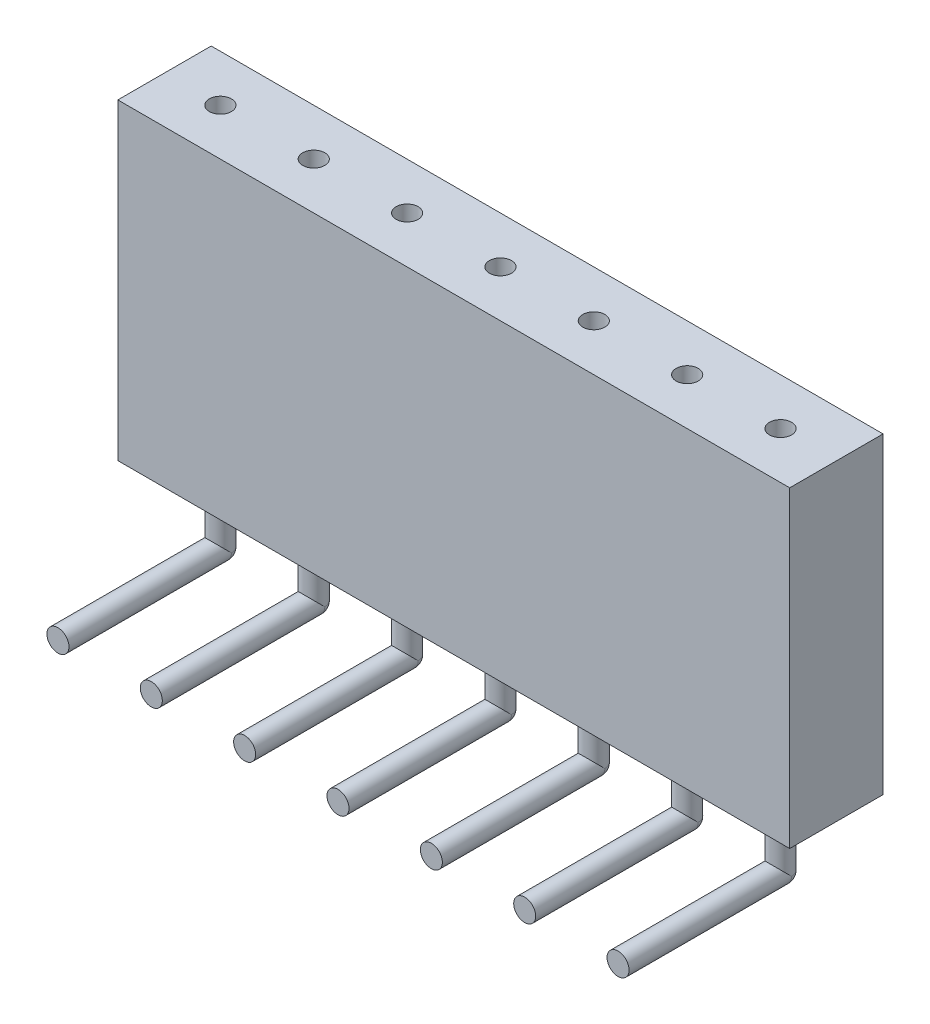
from build123d import *

# Parameters (mm, degrees)
SKETCH_1_W             = 18.28
SKETCH_1_H             = 2.54
EXTRUDE_1_DEPTH        = 8.5
SKETCH_2_R             = 0.3
CUT_EXTRUDE_1_DEPTH    = 8.5
SKETCH_3_R             = 0.3
EXTRUDE_2_DEPTH        = 1.9
EXTRUDE_2_2_DEPTH      = 1.9
EXTRUDE_2_3_DEPTH      = 1.9
EXTRUDE_2_4_DEPTH      = 1.9
EXTRUDE_2_5_DEPTH      = 1.9
EXTRUDE_2_6_DEPTH      = 1.9
EXTRUDE_2_7_DEPTH      = 1.9
EXTRUDE_3_DEPTH        = 4.42
EXTRUDE_3_DEPTH_BACK   = 0.3
SKETCH_4_R             = 0.3
EXTRUDE_3_2_DEPTH      = 4.42
EXTRUDE_3_2_DEPTH_BACK = 0.3
EXTRUDE_3_3_DEPTH      = 4.42
EXTRUDE_3_3_DEPTH_BACK = 0.3
EXTRUDE_3_4_DEPTH      = 4.42
EXTRUDE_3_4_DEPTH_BACK = 0.3
EXTRUDE_3_5_DEPTH      = 4.42
EXTRUDE_3_5_DEPTH_BACK = 0.3
EXTRUDE_3_6_DEPTH      = 4.42
EXTRUDE_3_6_DEPTH_BACK = 0.3
EXTRUDE_3_7_DEPTH      = 4.42
EXTRUDE_3_7_DEPTH_BACK = 0.3
FILLET_2_R             = 0.3
FILLET_3_R             = 0.3
FILLET_4_R             = 0.3
FILLET_5_R             = 0.3
FILLET_6_R             = 0.3
FILLET_7_R             = 0.3
FILLET_8_R             = 0.3


with BuildPart() as part:
    # Эскиз1 → Бобышка-Вытянуть1 (new body)
    with BuildSketch(Plane(origin=(0, 0, 0), x_dir=(1, 0, 0), z_dir=(0, 1, 0))):
        Rectangle(SKETCH_1_W, SKETCH_1_H)
    extrude(amount=EXTRUDE_1_DEPTH)

    # Эскиз2 → Вырез-Вытянуть1 (cut)
    with BuildSketch(Plane(origin=(0, 8.5, 0), x_dir=(1, 0, 0), z_dir=(0, 1, 0))):
        with Locations(Location((-7.62, 0, 0), (0, 0, 270))):
            Circle(SKETCH_2_R)
        with Locations(Location((-5.08, 0, 0), (0, 0, 270))):
            Circle(SKETCH_2_R)
        with Locations(Location((-2.54, 0, 0), (0, 0, 270))):
            Circle(SKETCH_2_R)
        with Locations(Location((0, 0, 0), (0, 0, 270))):
            Circle(SKETCH_2_R)
        with Locations(Location((2.54, 0, 0), (0, 0, 270))):
            Circle(SKETCH_2_R)
        with Locations(Location((5.08, 0, 0), (0, 0, 270))):
            Circle(SKETCH_2_R)
        with Locations(Location((7.62, 0, 0), (0, 0, 270))):
            Circle(SKETCH_2_R)
    extrude(amount=-CUT_EXTRUDE_1_DEPTH, mode=Mode.SUBTRACT)


with BuildPart() as body_2:
    # Эскиз3 → Бобышка-Вытянуть2 (new body)
    with BuildSketch(Plane.XZ):
        with Locations(Location((-7.62, 0, 0), (0, 0, 270))):
            Circle(SKETCH_3_R)
    extrude(amount=EXTRUDE_2_DEPTH)


with BuildPart() as body_3:
    # Эскиз3 → Extrude 2 2 (new body)
    with BuildSketch(Plane.XZ):
        with Locations(Location((-5.08, 0, 0), (0, 0, 270))):
            Circle(SKETCH_3_R)
    extrude(amount=EXTRUDE_2_2_DEPTH)


with BuildPart() as body_4:
    # Эскиз3 → Extrude 2 3 (new body)
    with BuildSketch(Plane.XZ):
        with Locations(Location((-2.54, 0, 0), (0, 0, 270))):
            Circle(SKETCH_3_R)
    extrude(amount=EXTRUDE_2_3_DEPTH)


with BuildPart() as body_5:
    # Эскиз3 → Extrude 2 4 (new body)
    with BuildSketch(Plane.XZ):
        with Locations(Location((0, 0, 0), (0, 0, 270))):
            Circle(SKETCH_3_R)
    extrude(amount=EXTRUDE_2_4_DEPTH)


with BuildPart() as body_6:
    # Эскиз3 → Extrude 2 5 (new body)
    with BuildSketch(Plane.XZ):
        with Locations(Location((2.54, 0, 0), (0, 0, 270))):
            Circle(SKETCH_3_R)
    extrude(amount=EXTRUDE_2_5_DEPTH)


with BuildPart() as body_7:
    # Эскиз3 → Extrude 2 6 (new body)
    with BuildSketch(Plane.XZ):
        with Locations(Location((5.08, 0, 0), (0, 0, 270))):
            Circle(SKETCH_3_R)
    extrude(amount=EXTRUDE_2_6_DEPTH)


with BuildPart() as body_8:
    # Эскиз3 → Extrude 2 7 (new body)
    with BuildSketch(Plane.XZ):
        with Locations(Location((7.62, 0, 0), (0, 0, 270))):
            Circle(SKETCH_3_R)
    extrude(amount=EXTRUDE_2_7_DEPTH)


with BuildPart() as body_9:
    # Эскиз4 → Бобышка-Вытянуть3 (new, two sides: drawn at the far end of the back side and taken through both)
    with BuildSketch(Plane.XY.offset(-EXTRUDE_3_DEPTH_BACK)):
        with Locations((-7.62, -1.9)):
            Circle(SKETCH_4_R)
    extrude(amount=EXTRUDE_3_DEPTH + EXTRUDE_3_DEPTH_BACK)

    # Скругление2
    fillet_2_edges = [body_9.edges().sort_by_distance(p)[0] for p in [
        (-7.92, -1.9, -0.3),
    ]]
    fillet(fillet_2_edges, radius=FILLET_2_R - 0.0001)  # a hair under: the kernel refuses the full size


with BuildPart() as body_10:
    # Эскиз4 → Extrude 3 2 (new, two sides: drawn at the far end of the back side and taken through both)
    with BuildSketch(Plane.XY.offset(-EXTRUDE_3_2_DEPTH_BACK)):
        with Locations((-5.08, -1.9)):
            Circle(SKETCH_4_R)
    extrude(amount=EXTRUDE_3_2_DEPTH + EXTRUDE_3_2_DEPTH_BACK)

    # Скругление3
    fillet_3_edges = [body_10.edges().sort_by_distance(p)[0] for p in [
        (-5.38, -1.9, -0.3),
    ]]
    fillet(fillet_3_edges, radius=FILLET_3_R - 0.0001)  # a hair under: the kernel refuses the full size


with BuildPart() as body_11:
    # Эскиз4 → Extrude 3 3 (new, two sides: drawn at the far end of the back side and taken through both)
    with BuildSketch(Plane.XY.offset(-EXTRUDE_3_3_DEPTH_BACK)):
        with Locations((-2.54, -1.9)):
            Circle(SKETCH_4_R)
    extrude(amount=EXTRUDE_3_3_DEPTH + EXTRUDE_3_3_DEPTH_BACK)

    # Скругление4
    fillet_4_edges = [body_11.edges().sort_by_distance(p)[0] for p in [
        (-2.84, -1.9, -0.3),
    ]]
    fillet(fillet_4_edges, radius=FILLET_4_R - 0.0001)  # a hair under: the kernel refuses the full size


with BuildPart() as body_12:
    # Эскиз4 → Extrude 3 4 (new, two sides: drawn at the far end of the back side and taken through both)
    with BuildSketch(Plane.XY.offset(-EXTRUDE_3_4_DEPTH_BACK)):
        with Locations((0, -1.9)):
            Circle(SKETCH_4_R)
    extrude(amount=EXTRUDE_3_4_DEPTH + EXTRUDE_3_4_DEPTH_BACK)

    # Скругление5
    fillet_5_edges = [body_12.edges().sort_by_distance(p)[0] for p in [
        (-0.3, -1.9, -0.3),
    ]]
    fillet(fillet_5_edges, radius=FILLET_5_R - 0.0001)  # a hair under: the kernel refuses the full size


with BuildPart() as body_13:
    # Эскиз4 → Extrude 3 5 (new, two sides: drawn at the far end of the back side and taken through both)
    with BuildSketch(Plane.XY.offset(-EXTRUDE_3_5_DEPTH_BACK)):
        with Locations((2.54, -1.9)):
            Circle(SKETCH_4_R)
    extrude(amount=EXTRUDE_3_5_DEPTH + EXTRUDE_3_5_DEPTH_BACK)

    # Скругление6
    fillet_6_edges = [body_13.edges().sort_by_distance(p)[0] for p in [
        (2.24, -1.9, -0.3),
    ]]
    fillet(fillet_6_edges, radius=FILLET_6_R - 0.0001)  # a hair under: the kernel refuses the full size


with BuildPart() as body_14:
    # Эскиз4 → Extrude 3 6 (new, two sides: drawn at the far end of the back side and taken through both)
    with BuildSketch(Plane.XY.offset(-EXTRUDE_3_6_DEPTH_BACK)):
        with Locations((5.08, -1.9)):
            Circle(SKETCH_4_R)
    extrude(amount=EXTRUDE_3_6_DEPTH + EXTRUDE_3_6_DEPTH_BACK)

    # Скругление7
    fillet_7_edges = [body_14.edges().sort_by_distance(p)[0] for p in [
        (4.78, -1.9, -0.3),
    ]]
    fillet(fillet_7_edges, radius=FILLET_7_R - 0.0001)  # a hair under: the kernel refuses the full size


with BuildPart() as body_15:
    # Эскиз4 → Extrude 3 7 (new, two sides: drawn at the far end of the back side and taken through both)
    with BuildSketch(Plane.XY.offset(-EXTRUDE_3_7_DEPTH_BACK)):
        with Locations((7.62, -1.9)):
            Circle(SKETCH_4_R)
    extrude(amount=EXTRUDE_3_7_DEPTH + EXTRUDE_3_7_DEPTH_BACK)

    # Скругление8
    fillet_8_edges = [body_15.edges().sort_by_distance(p)[0] for p in [
        (7.32, -1.9, -0.3),
    ]]
    fillet(fillet_8_edges, radius=FILLET_8_R - 0.0001)  # a hair under: the kernel refuses the full size


solid = Compound([part.part, body_2.part, body_3.part, body_4.part, body_5.part, body_6.part, body_7.part, body_8.part, body_9.part, body_10.part, body_11.part, body_12.part, body_13.part, body_14.part, body_15.part])
